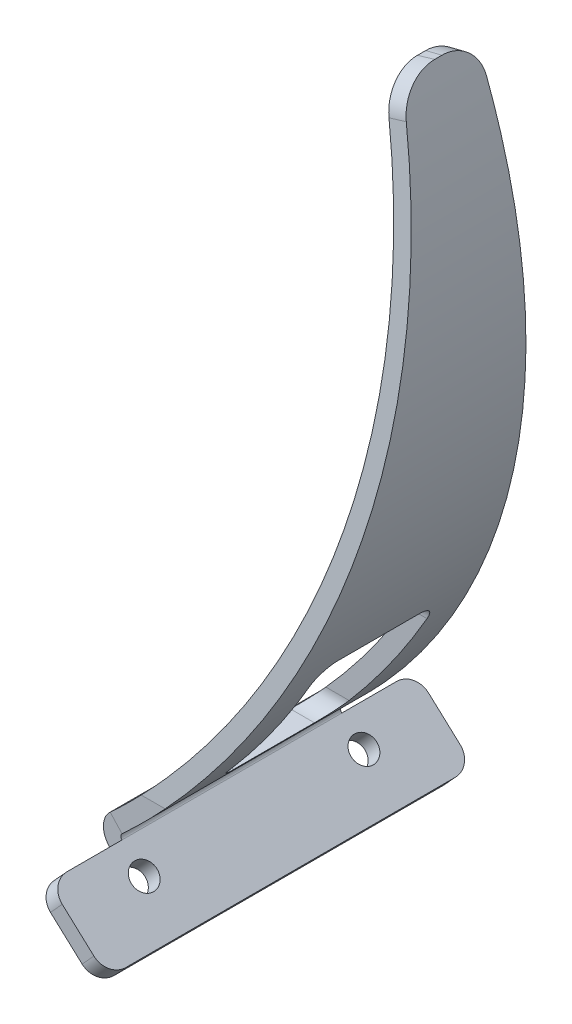
from build123d import *

# Parameters (mm, degrees)
BRIDA_BASE1_DEPTH          = 30
BRIDA_BASE1_DEPTH_BACK     = 30
BRIDA_DE_ARISTA1_DEPTH     = 60
CORTAR_EXTRUIR4_DEPTH      = 207.650630806
CORTAR_EXTRUIR4_DEPTH_BACK = 207.650630806
CROQUIS13_W                = 32
CROQUIS13_H                = 40
REDONDEO1_R                = 10
SALIENTE_EXTRUIR1_DEPTH    = 20
REDONDEO2_R                = 5
CORTAR_EXTRUIR5_REACH      = 213.826
CROQUIS18_R                = 3.5
REDONDEO3_R                = 5


# Sheet-metal steps are written as plain solids
with BuildPart() as part:
    # Croquis2 → Brida base1 (new, two sides: drawn at the far end of the back side and taken through both)
    with BuildSketch(Plane.XY.offset(-BRIDA_BASE1_DEPTH_BACK)):
        with BuildLine():
            ThreePointArc((0, 0), (54.558363857, 88.248906187), (55, 192))
            Line((55, 192), (59.586947027, 193.271816408))
            ThreePointArc((59.586947027, 193.271816408), (59.134317403, 86.938086161), (3.217852989, -3.507566413))
            Line((3.217852989, -3.507566413), (0, 0))
        make_face()
    extrude(amount=BRIDA_BASE1_DEPTH + BRIDA_BASE1_DEPTH_BACK)

    # Brida de arista1 section (across the edge) → Brida de arista1 (add)
    with BuildSketch(Plane(origin=(2.413685543, -4.245312279, 30), x_dir=(0.6751606504214892, 0.7376707233735331, 0), z_dir=(0, 0, -1))):
        with BuildLine():
            Line((-4.76, 1.091308501), (-4.76, 22.805371535))
            Line((-4.76, 22.805371535), (0, 22.805371535))
            Line((0, 22.805371535), (0, 1.091308501))
            ThreePointArc((0, 1.091308501), (0.324409792, 0.354031164), (1.087155743, 0.095113803))
            Line((1.087155743, 0.095113803), (1.502017078, -4.64677296))
            ThreePointArc((1.502017078, -4.64677296), (-2.891399596, -3.155408959), (-4.76, 1.091308501))
        make_face()
    extrude(amount=BRIDA_DE_ARISTA1_DEPTH)

    # Croquis13 → Cortar-Extruir4 (cut, two sides: drawn at the far end of the back side and taken through both)
    with BuildSketch(Plane(origin=(0, 0, 0), x_dir=(0, 0, -1), z_dir=(1, 0, 0)).offset(-CORTAR_EXTRUIR4_DEPTH_BACK)):
        Polygon((-10, 193.271816408), (-30, 8.271816408), (-30, 193.271816408), align=None)
        Polygon((30, 193.271816408), (10, 193.271816408), (30, 8.271816408), align=None)
        with Locations((0, 28)):
            Rectangle(CROQUIS13_W, CROQUIS13_H)
    extrude(amount=CORTAR_EXTRUIR4_DEPTH + CORTAR_EXTRUIR4_DEPTH_BACK, mode=Mode.SUBTRACT)

    # Redondeo1
    redondeo1_edges = [part.edges().sort_by_distance(p)[0] for p in [
        (57.293473513, 192.635908204, 10.068746833),
        (57.293473513, 192.635908204, -10.068746833),
    ]]
    fillet(redondeo1_edges, radius=REDONDEO1_R)

    # Croquis17 → Saliente-Extruir1 (add)
    with BuildSketch(Plane(origin=(0, 0, -30), x_dir=(-1, 0, 0), z_dir=(0, 0, -1))):
        Polygon((-16.022775764, -23.1539144), (-0.004947179, -8.493433479), (-3.218711875, -4.982120836), (-19.23654046, -19.642601757), align=None)
    saliente_extruir1 = extrude(amount=SALIENTE_EXTRUIR1_DEPTH)

    # Simetría1: Saliente-Extruir1 across plane
    add(saliente_extruir1.mirror(Plane.XY))

    # Redondeo2
    redondeo2_edges = [part.edges().sort_by_distance(p)[0] for p in [
        (17.629658112, -21.398258079, -50),
        (1.611829527, -6.737777158, -50),
        (17.629658112, -21.398258079, 50),
        (1.611829527, -6.737777158, 50),
    ]]
    fillet(redondeo2_edges, radius=REDONDEO2_R)

    # Croquis18 → Cortar-Extruir5 (cut, up to next)
    with BuildSketch(Plane(origin=(-1.014102827, -1.107994025, 0), x_dir=(0, 0, -1), z_dir=(0.6751606504214892, 0.7376707233735331, 0)), mode=Mode.PRIVATE) as cortar_extruir5_sk1:
        with Locations(Location((30, -13.952144495, 0), (0, 0, 90))):
            Circle(CROQUIS18_R)
    cortar_extruir5_tool1 = extrude(cortar_extruir5_sk1.sketch, amount=-CORTAR_EXTRUIR5_REACH, mode=Mode.PRIVATE) & part.part
    # Croquis18 → Cortar-Extruir5 (cut, up to next)
    with BuildSketch(Plane(origin=(-1.014102827, -1.107994025, 0), x_dir=(0, 0, -1), z_dir=(0.6751606504214892, 0.7376707233735331, 0)), mode=Mode.PRIVATE) as cortar_extruir5_sk2:
        with Locations(Location((-30, -13.952144495, 0), (0, 0, 270))):
            Circle(CROQUIS18_R)
    cortar_extruir5_tool2 = extrude(cortar_extruir5_sk2.sketch, amount=-CORTAR_EXTRUIR5_REACH, mode=Mode.PRIVATE) & part.part
    add(cortar_extruir5_tool1.solids().sort_by_distance((9.277986, -10.527933, -30))[0], mode=Mode.SUBTRACT)
    add(cortar_extruir5_tool2.solids().sort_by_distance((9.277986, -10.527933, 30))[0], mode=Mode.SUBTRACT)

    # Redondeo3
    redondeo3_edges = [part.edges().sort_by_distance(p)[0] for p in [
        (40.577357411, 48, -16),
        (11.485461299, 8, -16),
        (11.485461299, 8, 16),
        (40.577357411, 48, 16),
    ]]
    fillet(redondeo3_edges, radius=REDONDEO3_R)


solid = part.part
